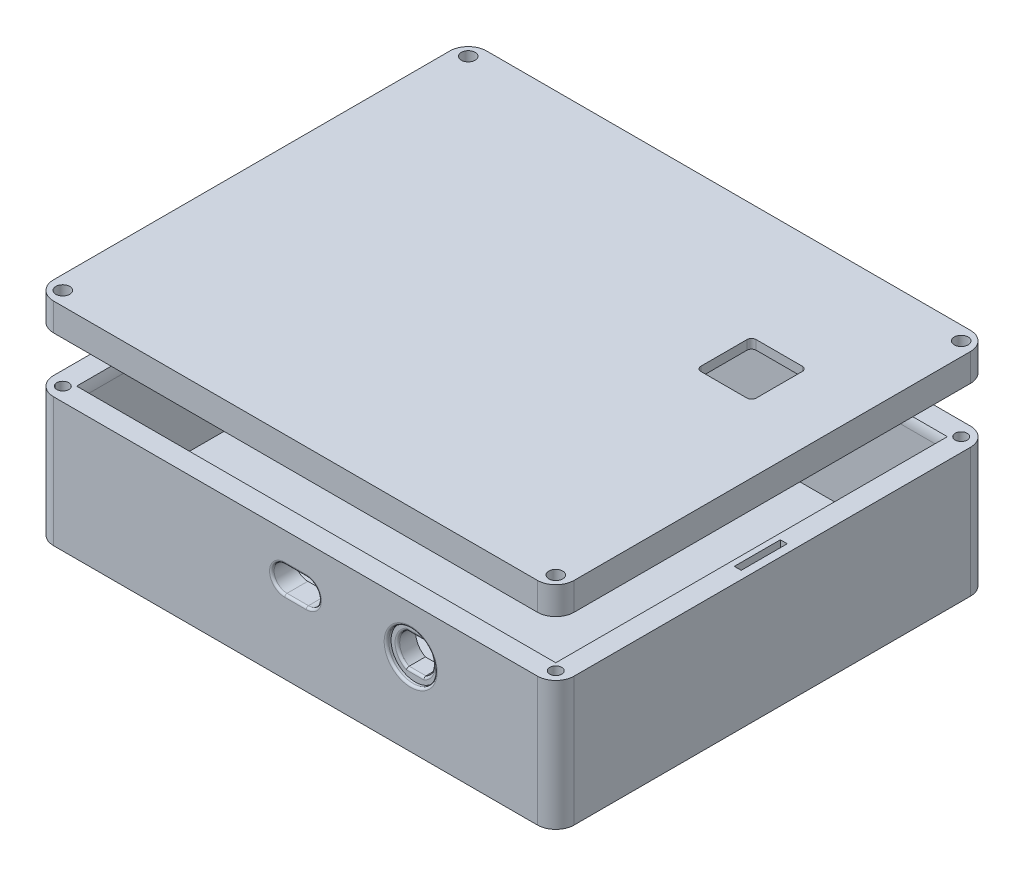
from build123d import *

# Parameters (mm, degrees)
BOSS_EXTRUDE1_DEPTH      = 4
BOSS_EXTRUDE2_START      = 4
SKETCH1_3_W              = 103
SKETCH1_3_H              = 84
BOSS_EXTRUDE2_DEPTH      = 24
BOSS_EXTRUDE3_START      = 4
SKETCH1_4_W              = 1.5
SKETCH1_4_H              = 12
SKETCH1_4_W_2            = 2.5
SKETCH1_4_H_2            = 1.5
BOSS_EXTRUDE3_DEPTH      = 8
CHAMFER1_SIZE            = 1
CUT_EXTRUDE1_DEPTH       = 11
CUT_EXTRUDE2_START       = 5
SKETCH2_3_R              = 5.25
CUT_EXTRUDE2_DEPTH       = 1
CHAMFER2_SIZE            = 0.5
FILLET1_R                = 5
FILLET2_R                = 0.5
SKETCH3_R                = 1.3
SKETCH3_W                = 1.5
SKETCH3_H                = 10
CUT_EXTRUDE3_DEPTH       = 8
SKETCH4_R                = 1.5
SKETCH4_W                = 103
SKETCH4_H                = 84
BOSS_EXTRUDE4_DEPTH      = 4
SKETCH4_5_W              = 1
SKETCH4_5_H              = 9.5
BOSS_EXTRUDE7_DEPTH      = 2
BOSS_EXTRUDE5_DEPTH      = 4
BOSS_EXTRUDE5_DEPTH_BACK = 3
SKETCH4_3_W              = 103
SKETCH4_3_H              = 84
SKETCH4_3_W_2            = 95
SKETCH4_3_H_2            = 76
CHAMFER3_SIZE            = 1
CHAMFER3_SIZE2           = 2.747477419
BOSS_EXTRUDE17_START     = 4
BOSS_EXTRUDE17_OUTLINE_R = 1.5
BOSS_EXTRUDE17_DEPTH     = 2
CUT_EXTRUDE11_DEPTH      = 10


# Read off the part's stored shape, not the designer's step: Boss-Extrude17
with BuildPart() as part:
    # Sketch1 → Boss-Extrude1 (new body)
    with BuildSketch(Plane(origin=(0, 0, 0), x_dir=(1, 0, 0), z_dir=(0, 1, 0))):
        with BuildLine():
            Line((-1, 89), (104, 89))
            ThreePointArc((104, 89), (106.828427125, 87.828427125), (108, 85))
            Line((108, 85), (108, -1))
            ThreePointArc((108, -1), (106.828427125, -3.828427125), (104, -5))
            Line((104, -5), (-1, -5))
            ThreePointArc((-1, -5), (-3.828427125, -3.828427125), (-5, -1))
            Line((-5, -1), (-5, 85))
            ThreePointArc((-5, 85), (-3.828427125, 87.828427125), (-1, 89))
        make_face()
    extrude(amount=BOSS_EXTRUDE1_DEPTH)

    # Sketch1<3> → Boss-Extrude2 (add)
    with BuildSketch(Plane(origin=(0, 0, 0), x_dir=(1, 0, 0), z_dir=(0, 1, 0)).offset(BOSS_EXTRUDE2_START)):
        with BuildLine():
            Line((-1, 89), (104, 89))
            ThreePointArc((104, 89), (106.828427125, 87.828427125), (108, 85))
            Line((108, 85), (108, -1))
            ThreePointArc((108, -1), (106.828427125, -3.828427125), (104, -5))
            Line((104, -5), (-1, -5))
            ThreePointArc((-1, -5), (-3.828427125, -3.828427125), (-5, -1))
            Line((-5, -1), (-5, 85))
            ThreePointArc((-5, 85), (-3.828427125, 87.828427125), (-1, 89))
        make_face()
        with Locations((51.5, 42)):
            Rectangle(SKETCH1_3_W, SKETCH1_3_H, mode=Mode.SUBTRACT)
    extrude(amount=BOSS_EXTRUDE2_DEPTH)

    # Sketch1<4> → Boss-Extrude3 (add)
    with BuildSketch(Plane(origin=(0, 0, 0), x_dir=(1, 0, 0), z_dir=(0, 1, 0)).offset(BOSS_EXTRUDE3_START)):
        with Locations((0.75, 78)):
            Rectangle(SKETCH1_4_W, SKETCH1_4_H)
        Polygon((0, 13.5), (0, 0), (1.5, 0), (1.5, 1.5), (1.5, 13.5), align=None)
        with Locations((2.75, 0.75)):
            Rectangle(SKETCH1_4_W_2, SKETCH1_4_H_2)
    extrude(amount=BOSS_EXTRUDE3_DEPTH)

    # Chamfer1
    chamfer1_edges = [part.edges().sort_by_distance(p)[0] for p in [
        (0.75, 12, -72),
        (1.5, 12, -78),
        (1.5, 12, -7.5),
        (0.75, 12, -13.5),
        (4, 12, -0.75),
        (2.75, 12, -1.5),
    ]]
    chamfer(chamfer1_edges, length=CHAMFER1_SIZE)

    # Sketch2 → Cut-Extrude1 (cut)
    with BuildSketch(Plane.XY):
        with BuildLine():
            Line((49.175, 15.9), (53.825, 15.9))
            ThreePointArc((53.825, 15.9), (56.625, 18.7), (53.825, 21.5))
            Line((53.825, 21.5), (49.175, 21.5))
            ThreePointArc((49.175, 21.5), (46.375, 18.7), (49.175, 15.9))
        make_face()
        with BuildLine():
            Line((74.687543104, 14.45), (78.312456896, 14.45))
            ThreePointArc((78.312456896, 14.45), (80.375, 17.875), (78.312456896, 21.3))
            Line((78.312456896, 21.3), (74.687543104, 21.3))
            ThreePointArc((74.687543104, 21.3), (72.625, 17.875), (74.687543104, 14.45))
        make_face()
    extrude(amount=CUT_EXTRUDE1_DEPTH, mode=Mode.SUBTRACT)

    # Sketch2<3> → Cut-Extrude2 (cut)
    with BuildSketch(Plane.XY.offset(CUT_EXTRUDE2_START)):
        with Locations(Location((76.5, 17.875, 0), (0, 0, 180))):
            Circle(SKETCH2_3_R)
    extrude(amount=-CUT_EXTRUDE2_DEPTH, mode=Mode.SUBTRACT)

    # Chamfer2
    chamfer2_edges = [part.edges().sort_by_distance(p)[0] for p in [
        (0, 28, -42),
        (51.5, 28, -84),
        (51.5, 28, 0),
        (103, 28, -42),
    ]]
    chamfer(chamfer2_edges, length=CHAMFER2_SIZE)

    # Fillet1
    # the kernel refuses this fillet: 5 mm, written as the material it takes off along each edge
    with BuildSketch(Plane(origin=(-4.198623679, 27.5, 0), x_dir=(0, -1, 0), z_dir=(1, 0, 0))) as fillet1_piece_1_section:
        with BuildLine():
            CenterArc((1.679449472, -5), FILLET1_R, 90, 25.841932763)
            Line((-0.5, -0.5), (-0.543588989, -0.41))
            ThreePointArc((-0.543588989, -0.41), (-0.320710678, -0.179289322), (-0.070710678, 0.070710678))
            Line((-0.070710678, 0.070710678), (0, 0.1))
            Line((0, 0.1), (1.679449472, 0.1))
            Line((1.679449472, 0.1), (1.679449472, 0))
        make_face()
    fillet1_piece_1 = extrude(amount=107.198623679, mode=Mode.PRIVATE)
    fillet1_piece_1 = split(fillet1_piece_1, bisect_by=Plane(origin=(0, 27.809434644, 0.291148334), z_dir=(-1, 0, 0)), keep=Keep.TOP, mode=Mode.PRIVATE)
    fillet1_piece_1 = split(fillet1_piece_1, bisect_by=Plane(origin=(-0.232075983, 27.732075983, 0.291148334), z_dir=(0.7071067811865476, 0.7071067811865476, 0)), keep=Keep.TOP, mode=Mode.PRIVATE)
    add(fillet1_piece_1, mode=Mode.SUBTRACT)
    with BuildSketch(Plane(origin=(0, 27.5, 0), x_dir=(0, -1, 0), z_dir=(1, 0, 0))) as fillet1_piece_2_section:
        with BuildLine():
            CenterArc((1.679449472, -5), FILLET1_R, 90, 25.841932763)
            Line((-0.5, -0.5), (-0.543588989, -0.41))
            ThreePointArc((-0.543588989, -0.41), (-0.320710678, -0.179289322), (-0.070710678, 0.070710678))
            Line((-0.070710678, 0.070710678), (0, 0.1))
            Line((0, 0.1), (1.679449472, 0.1))
            Line((1.679449472, 0.1), (1.679449472, 0))
        make_face()
    fillet1_piece_2 = extrude(amount=103, mode=Mode.PRIVATE)
    fillet1_piece_2 = split(fillet1_piece_2, bisect_by=Plane(origin=(0.730926762, 26.769073238, -0.015345382), z_dir=(-0.7071067811865476, -0.7071067811865476, 0)), keep=Keep.TOP, mode=Mode.PRIVATE)
    add(fillet1_piece_2, mode=Mode.SUBTRACT)
    with BuildSketch(Plane(origin=(0, 27.5, 0), x_dir=(0, -1, 0), z_dir=(1, 0, 0))) as fillet1_piece_3_section:
        with BuildLine():
            CenterArc((1.679449472, -5), FILLET1_R, 90, 25.841932763)
            Line((-0.5, -0.5), (-0.543588989, -0.41))
            ThreePointArc((-0.543588989, -0.41), (-0.320710678, -0.179289322), (-0.070710678, 0.070710678))
            Line((-0.070710678, 0.070710678), (0, 0.1))
            Line((0, 0.1), (1.679449472, 0.1))
            Line((1.679449472, 0.1), (1.679449472, 0))
        make_face()
    fillet1_piece_3 = extrude(amount=103, mode=Mode.PRIVATE)
    fillet1_piece_3 = split(fillet1_piece_3, bisect_by=Plane(origin=(25.936183283, 1.563816717, 0.080709019), z_dir=(0.7071067811865476, 0.7071067811865476, 0)), keep=Keep.TOP, mode=Mode.PRIVATE)
    fillet1_piece_3 = split(fillet1_piece_3, bisect_by=Plane(origin=(77.063816717, 1.563816717, 0.080709019), z_dir=(-0.7071067811865476, 0.7071067811865476, 0)), keep=Keep.TOP, mode=Mode.PRIVATE)
    add(fillet1_piece_3, mode=Mode.SUBTRACT)
    with BuildSketch(Plane(origin=(0, 27.5, 0), x_dir=(0, -1, 0), z_dir=(1, 0, 0))) as fillet1_piece_4_section:
        with BuildLine():
            CenterArc((1.679449472, -5), FILLET1_R, 90, 25.841932763)
            Line((-0.5, -0.5), (-0.543588989, -0.41))
            ThreePointArc((-0.543588989, -0.41), (-0.320710678, -0.179289322), (-0.070710678, 0.070710678))
            Line((-0.070710678, 0.070710678), (0, 0.1))
            Line((0, 0.1), (1.679449472, 0.1))
            Line((1.679449472, 0.1), (1.679449472, 0))
        make_face()
    fillet1_piece_4 = extrude(amount=107.198623679, mode=Mode.PRIVATE)
    fillet1_piece_4 = split(fillet1_piece_4, bisect_by=Plane(origin=(103, 27.809434644, 0.291148334), z_dir=(1, 0, 0)), keep=Keep.TOP, mode=Mode.PRIVATE)
    fillet1_piece_4 = split(fillet1_piece_4, bisect_by=Plane(origin=(103.232075983, 27.732075983, 0.291148334), z_dir=(-0.7071067811865476, 0.7071067811865476, 0)), keep=Keep.TOP, mode=Mode.PRIVATE)
    add(fillet1_piece_4, mode=Mode.SUBTRACT)
    with BuildSketch(Plane(origin=(0, 27.5, 0), x_dir=(0, -1, 0), z_dir=(1, 0, 0))) as fillet1_piece_5_section:
        with BuildLine():
            CenterArc((1.679449472, -5), FILLET1_R, 90, 25.841932763)
            Line((-0.5, -0.5), (-0.543588989, -0.41))
            ThreePointArc((-0.543588989, -0.41), (-0.320710678, -0.179289322), (-0.070710678, 0.070710678))
            Line((-0.070710678, 0.070710678), (0, 0.1))
            Line((0, 0.1), (1.679449472, 0.1))
            Line((1.679449472, 0.1), (1.679449472, 0))
        make_face()
    fillet1_piece_5 = extrude(amount=103, mode=Mode.PRIVATE)
    fillet1_piece_5 = split(fillet1_piece_5, bisect_by=Plane(origin=(102.269073238, 26.769073238, -0.015345382), z_dir=(0.7071067811865476, -0.7071067811865476, 0)), keep=Keep.TOP, mode=Mode.PRIVATE)
    add(fillet1_piece_5, mode=Mode.SUBTRACT)
    with BuildSketch(Plane(origin=(103, 27.5, 4.198623679), x_dir=(0, -1, 0), z_dir=(0, 0, -1))) as fillet1_piece_6_section:
        with BuildLine():
            CenterArc((1.679449472, -5), FILLET1_R, 90, 25.841932763)
            Line((-0.5, -0.5), (-0.543588989, -0.41))
            ThreePointArc((-0.543588989, -0.41), (-0.320710678, -0.179289322), (-0.070710678, 0.070710678))
            Line((-0.070710678, 0.070710678), (0, 0.1))
            Line((0, 0.1), (1.679449472, 0.1))
            Line((1.679449472, 0.1), (1.679449472, 0))
        make_face()
    fillet1_piece_6 = extrude(amount=88.198623679, mode=Mode.PRIVATE)
    fillet1_piece_6 = split(fillet1_piece_6, bisect_by=Plane(origin=(103.291148334, 27.809434644, 0), z_dir=(0, 0, 1)), keep=Keep.TOP, mode=Mode.PRIVATE)
    fillet1_piece_6 = split(fillet1_piece_6, bisect_by=Plane(origin=(103.291148334, 27.732075983, 0.232075983), z_dir=(0, 0.7071067811865476, -0.7071067811865476)), keep=Keep.TOP, mode=Mode.PRIVATE)
    add(fillet1_piece_6, mode=Mode.SUBTRACT)
    with BuildSketch(Plane(origin=(103, 27.5, 0), x_dir=(0, -1, 0), z_dir=(0, 0, -1))) as fillet1_piece_7_section:
        with BuildLine():
            CenterArc((1.679449472, -5), FILLET1_R, 90, 25.841932763)
            Line((-0.5, -0.5), (-0.543588989, -0.41))
            ThreePointArc((-0.543588989, -0.41), (-0.320710678, -0.179289322), (-0.070710678, 0.070710678))
            Line((-0.070710678, 0.070710678), (0, 0.1))
            Line((0, 0.1), (1.679449472, 0.1))
            Line((1.679449472, 0.1), (1.679449472, 0))
        make_face()
    fillet1_piece_7 = extrude(amount=84, mode=Mode.PRIVATE)
    fillet1_piece_7 = split(fillet1_piece_7, bisect_by=Plane(origin=(102.984654618, 26.769073238, -0.730926762), z_dir=(0, -0.7071067811865476, 0.7071067811865476)), keep=Keep.TOP, mode=Mode.PRIVATE)
    add(fillet1_piece_7, mode=Mode.SUBTRACT)
    with BuildSketch(Plane(origin=(103, 27.5, 0), x_dir=(0, -1, 0), z_dir=(0, 0, -1))) as fillet1_piece_8_section:
        with BuildLine():
            CenterArc((1.679449472, -5), FILLET1_R, 90, 25.841932763)
            Line((-0.5, -0.5), (-0.543588989, -0.41))
            ThreePointArc((-0.543588989, -0.41), (-0.320710678, -0.179289322), (-0.070710678, 0.070710678))
            Line((-0.070710678, 0.070710678), (0, 0.1))
            Line((0, 0.1), (1.679449472, 0.1))
            Line((1.679449472, 0.1), (1.679449472, 0))
        make_face()
    fillet1_piece_8 = extrude(amount=84, mode=Mode.PRIVATE)
    fillet1_piece_8 = split(fillet1_piece_8, bisect_by=Plane(origin=(103.080897573, 6.314407777, -21.185592223), z_dir=(0, 0.7071067811865476, -0.7071067811865476)), keep=Keep.TOP, mode=Mode.PRIVATE)
    fillet1_piece_8 = split(fillet1_piece_8, bisect_by=Plane(origin=(103.080897573, 6.314407777, -62.814407777), z_dir=(0, 0.7071067811865476, 0.7071067811865476)), keep=Keep.TOP, mode=Mode.PRIVATE)
    add(fillet1_piece_8, mode=Mode.SUBTRACT)
    with BuildSketch(Plane(origin=(103, 27.5, 0), x_dir=(0, -1, 0), z_dir=(0, 0, -1))) as fillet1_piece_9_section:
        with BuildLine():
            CenterArc((1.679449472, -5), FILLET1_R, 90, 25.841932763)
            Line((-0.5, -0.5), (-0.543588989, -0.41))
            ThreePointArc((-0.543588989, -0.41), (-0.320710678, -0.179289322), (-0.070710678, 0.070710678))
            Line((-0.070710678, 0.070710678), (0, 0.1))
            Line((0, 0.1), (1.679449472, 0.1))
            Line((1.679449472, 0.1), (1.679449472, 0))
        make_face()
    fillet1_piece_9 = extrude(amount=88.198623679, mode=Mode.PRIVATE)
    fillet1_piece_9 = split(fillet1_piece_9, bisect_by=Plane(origin=(103.291148334, 27.809434644, -84), z_dir=(0, 0, -1)), keep=Keep.TOP, mode=Mode.PRIVATE)
    fillet1_piece_9 = split(fillet1_piece_9, bisect_by=Plane(origin=(103.291148334, 27.732075983, -84.232075983), z_dir=(0, 0.7071067811865476, 0.7071067811865476)), keep=Keep.TOP, mode=Mode.PRIVATE)
    add(fillet1_piece_9, mode=Mode.SUBTRACT)
    with BuildSketch(Plane(origin=(103, 27.5, 0), x_dir=(0, -1, 0), z_dir=(0, 0, -1))) as fillet1_piece_10_section:
        with BuildLine():
            CenterArc((1.679449472, -5), FILLET1_R, 90, 25.841932763)
            Line((-0.5, -0.5), (-0.543588989, -0.41))
            ThreePointArc((-0.543588989, -0.41), (-0.320710678, -0.179289322), (-0.070710678, 0.070710678))
            Line((-0.070710678, 0.070710678), (0, 0.1))
            Line((0, 0.1), (1.679449472, 0.1))
            Line((1.679449472, 0.1), (1.679449472, 0))
        make_face()
    fillet1_piece_10 = extrude(amount=84, mode=Mode.PRIVATE)
    fillet1_piece_10 = split(fillet1_piece_10, bisect_by=Plane(origin=(102.984654618, 26.769073238, -83.269073238), z_dir=(0, -0.7071067811865476, -0.7071067811865476)), keep=Keep.TOP, mode=Mode.PRIVATE)
    add(fillet1_piece_10, mode=Mode.SUBTRACT)
    with BuildSketch(Plane(origin=(107.198623679, 27.5, -84), x_dir=(0, -1, 0), z_dir=(-1, 0, 0))) as fillet1_piece_11_section:
        with BuildLine():
            CenterArc((1.679449472, -5), FILLET1_R, 90, 25.841932763)
            Line((-0.5, -0.5), (-0.543588989, -0.41))
            ThreePointArc((-0.543588989, -0.41), (-0.320710678, -0.179289322), (-0.070710678, 0.070710678))
            Line((-0.070710678, 0.070710678), (0, 0.1))
            Line((0, 0.1), (1.679449472, 0.1))
            Line((1.679449472, 0.1), (1.679449472, 0))
        make_face()
    fillet1_piece_11 = extrude(amount=107.198623679, mode=Mode.PRIVATE)
    fillet1_piece_11 = split(fillet1_piece_11, bisect_by=Plane(origin=(103, 27.809434644, -84.291148334), z_dir=(1, 0, 0)), keep=Keep.TOP, mode=Mode.PRIVATE)
    fillet1_piece_11 = split(fillet1_piece_11, bisect_by=Plane(origin=(103.232075983, 27.732075983, -84.291148334), z_dir=(-0.7071067811865476, 0.7071067811865476, 0)), keep=Keep.TOP, mode=Mode.PRIVATE)
    add(fillet1_piece_11, mode=Mode.SUBTRACT)
    with BuildSketch(Plane(origin=(103, 27.5, -84), x_dir=(0, -1, 0), z_dir=(-1, 0, 0))) as fillet1_piece_12_section:
        with BuildLine():
            CenterArc((1.679449472, -5), FILLET1_R, 90, 25.841932763)
            Line((-0.5, -0.5), (-0.543588989, -0.41))
            ThreePointArc((-0.543588989, -0.41), (-0.320710678, -0.179289322), (-0.070710678, 0.070710678))
            Line((-0.070710678, 0.070710678), (0, 0.1))
            Line((0, 0.1), (1.679449472, 0.1))
            Line((1.679449472, 0.1), (1.679449472, 0))
        make_face()
    fillet1_piece_12 = extrude(amount=103, mode=Mode.PRIVATE)
    fillet1_piece_12 = split(fillet1_piece_12, bisect_by=Plane(origin=(102.269073238, 26.769073238, -83.984654618), z_dir=(0.7071067811865476, -0.7071067811865476, 0)), keep=Keep.TOP, mode=Mode.PRIVATE)
    add(fillet1_piece_12, mode=Mode.SUBTRACT)
    with BuildSketch(Plane(origin=(103, 27.5, -84), x_dir=(0, -1, 0), z_dir=(-1, 0, 0))) as fillet1_piece_13_section:
        with BuildLine():
            CenterArc((1.679449472, -5), FILLET1_R, 90, 25.841932763)
            Line((-0.5, -0.5), (-0.543588989, -0.41))
            ThreePointArc((-0.543588989, -0.41), (-0.320710678, -0.179289322), (-0.070710678, 0.070710678))
            Line((-0.070710678, 0.070710678), (0, 0.1))
            Line((0, 0.1), (1.679449472, 0.1))
            Line((1.679449472, 0.1), (1.679449472, 0))
        make_face()
    fillet1_piece_13 = extrude(amount=103, mode=Mode.PRIVATE)
    fillet1_piece_13 = split(fillet1_piece_13, bisect_by=Plane(origin=(25.936183283, 1.563816717, -84.080709019), z_dir=(0.7071067811865476, 0.7071067811865476, 0)), keep=Keep.TOP, mode=Mode.PRIVATE)
    fillet1_piece_13 = split(fillet1_piece_13, bisect_by=Plane(origin=(77.063816717, 1.563816717, -84.080709019), z_dir=(-0.7071067811865476, 0.7071067811865476, 0)), keep=Keep.TOP, mode=Mode.PRIVATE)
    add(fillet1_piece_13, mode=Mode.SUBTRACT)
    with BuildSketch(Plane(origin=(103, 27.5, -84), x_dir=(0, -1, 0), z_dir=(-1, 0, 0))) as fillet1_piece_14_section:
        with BuildLine():
            CenterArc((1.679449472, -5), FILLET1_R, 90, 25.841932763)
            Line((-0.5, -0.5), (-0.543588989, -0.41))
            ThreePointArc((-0.543588989, -0.41), (-0.320710678, -0.179289322), (-0.070710678, 0.070710678))
            Line((-0.070710678, 0.070710678), (0, 0.1))
            Line((0, 0.1), (1.679449472, 0.1))
            Line((1.679449472, 0.1), (1.679449472, 0))
        make_face()
    fillet1_piece_14 = extrude(amount=107.198623679, mode=Mode.PRIVATE)
    fillet1_piece_14 = split(fillet1_piece_14, bisect_by=Plane(origin=(0, 27.809434644, -84.291148334), z_dir=(-1, 0, 0)), keep=Keep.TOP, mode=Mode.PRIVATE)
    fillet1_piece_14 = split(fillet1_piece_14, bisect_by=Plane(origin=(-0.232075983, 27.732075983, -84.291148334), z_dir=(0.7071067811865476, 0.7071067811865476, 0)), keep=Keep.TOP, mode=Mode.PRIVATE)
    add(fillet1_piece_14, mode=Mode.SUBTRACT)
    with BuildSketch(Plane(origin=(103, 27.5, -84), x_dir=(0, -1, 0), z_dir=(-1, 0, 0))) as fillet1_piece_15_section:
        with BuildLine():
            CenterArc((1.679449472, -5), FILLET1_R, 90, 25.841932763)
            Line((-0.5, -0.5), (-0.543588989, -0.41))
            ThreePointArc((-0.543588989, -0.41), (-0.320710678, -0.179289322), (-0.070710678, 0.070710678))
            Line((-0.070710678, 0.070710678), (0, 0.1))
            Line((0, 0.1), (1.679449472, 0.1))
            Line((1.679449472, 0.1), (1.679449472, 0))
        make_face()
    fillet1_piece_15 = extrude(amount=103, mode=Mode.PRIVATE)
    fillet1_piece_15 = split(fillet1_piece_15, bisect_by=Plane(origin=(0.730926762, 26.769073238, -83.984654618), z_dir=(-0.7071067811865476, -0.7071067811865476, 0)), keep=Keep.TOP, mode=Mode.PRIVATE)
    add(fillet1_piece_15, mode=Mode.SUBTRACT)
    with BuildSketch(Plane(origin=(0, 27.5, -88.198623679), x_dir=(0, -1, 0), z_dir=(0, 0, 1))) as fillet1_piece_16_section:
        with BuildLine():
            CenterArc((1.679449472, -5), FILLET1_R, 90, 25.841932763)
            Line((-0.5, -0.5), (-0.543588989, -0.41))
            ThreePointArc((-0.543588989, -0.41), (-0.320710678, -0.179289322), (-0.070710678, 0.070710678))
            Line((-0.070710678, 0.070710678), (0, 0.1))
            Line((0, 0.1), (1.679449472, 0.1))
            Line((1.679449472, 0.1), (1.679449472, 0))
        make_face()
    fillet1_piece_16 = extrude(amount=88.198623679, mode=Mode.PRIVATE)
    fillet1_piece_16 = split(fillet1_piece_16, bisect_by=Plane(origin=(-0.291148334, 27.809434644, -84), z_dir=(0, 0, -1)), keep=Keep.TOP, mode=Mode.PRIVATE)
    fillet1_piece_16 = split(fillet1_piece_16, bisect_by=Plane(origin=(-0.291148334, 27.732075983, -84.232075983), z_dir=(0, 0.7071067811865476, 0.7071067811865476)), keep=Keep.TOP, mode=Mode.PRIVATE)
    add(fillet1_piece_16, mode=Mode.SUBTRACT)
    with BuildSketch(Plane(origin=(0, 27.5, -84), x_dir=(0, -1, 0), z_dir=(0, 0, 1))) as fillet1_piece_17_section:
        with BuildLine():
            CenterArc((1.679449472, -5), FILLET1_R, 90, 25.841932763)
            Line((-0.5, -0.5), (-0.543588989, -0.41))
            ThreePointArc((-0.543588989, -0.41), (-0.320710678, -0.179289322), (-0.070710678, 0.070710678))
            Line((-0.070710678, 0.070710678), (0, 0.1))
            Line((0, 0.1), (1.679449472, 0.1))
            Line((1.679449472, 0.1), (1.679449472, 0))
        make_face()
    fillet1_piece_17 = extrude(amount=84, mode=Mode.PRIVATE)
    fillet1_piece_17 = split(fillet1_piece_17, bisect_by=Plane(origin=(0.015345382, 26.769073238, -83.269073238), z_dir=(0, -0.7071067811865476, -0.7071067811865476)), keep=Keep.TOP, mode=Mode.PRIVATE)
    add(fillet1_piece_17, mode=Mode.SUBTRACT)
    with BuildSketch(Plane(origin=(0, 27.5, -84), x_dir=(0, -1, 0), z_dir=(0, 0, 1))) as fillet1_piece_18_section:
        with BuildLine():
            CenterArc((1.679449472, -5), FILLET1_R, 90, 25.841932763)
            Line((-0.5, -0.5), (-0.543588989, -0.41))
            ThreePointArc((-0.543588989, -0.41), (-0.320710678, -0.179289322), (-0.070710678, 0.070710678))
            Line((-0.070710678, 0.070710678), (0, 0.1))
            Line((0, 0.1), (1.679449472, 0.1))
            Line((1.679449472, 0.1), (1.679449472, 0))
        make_face()
    fillet1_piece_18 = extrude(amount=84, mode=Mode.PRIVATE)
    fillet1_piece_18 = split(fillet1_piece_18, bisect_by=Plane(origin=(-0.080897573, 6.314407777, -21.185592223), z_dir=(0, 0.7071067811865476, -0.7071067811865476)), keep=Keep.TOP, mode=Mode.PRIVATE)
    fillet1_piece_18 = split(fillet1_piece_18, bisect_by=Plane(origin=(-0.080897573, 6.314407777, -62.814407777), z_dir=(0, 0.7071067811865476, 0.7071067811865476)), keep=Keep.TOP, mode=Mode.PRIVATE)
    add(fillet1_piece_18, mode=Mode.SUBTRACT)
    with BuildSketch(Plane(origin=(0, 27.5, -84), x_dir=(0, -1, 0), z_dir=(0, 0, 1))) as fillet1_piece_19_section:
        with BuildLine():
            CenterArc((1.679449472, -5), FILLET1_R, 90, 25.841932763)
            Line((-0.5, -0.5), (-0.543588989, -0.41))
            ThreePointArc((-0.543588989, -0.41), (-0.320710678, -0.179289322), (-0.070710678, 0.070710678))
            Line((-0.070710678, 0.070710678), (0, 0.1))
            Line((0, 0.1), (1.679449472, 0.1))
            Line((1.679449472, 0.1), (1.679449472, 0))
        make_face()
    fillet1_piece_19 = extrude(amount=88.198623679, mode=Mode.PRIVATE)
    fillet1_piece_19 = split(fillet1_piece_19, bisect_by=Plane(origin=(-0.291148334, 27.809434644, 0), z_dir=(0, 0, 1)), keep=Keep.TOP, mode=Mode.PRIVATE)
    fillet1_piece_19 = split(fillet1_piece_19, bisect_by=Plane(origin=(-0.291148334, 27.732075983, 0.232075983), z_dir=(0, 0.7071067811865476, -0.7071067811865476)), keep=Keep.TOP, mode=Mode.PRIVATE)
    add(fillet1_piece_19, mode=Mode.SUBTRACT)
    with BuildSketch(Plane(origin=(0, 27.5, -84), x_dir=(0, -1, 0), z_dir=(0, 0, 1))) as fillet1_piece_20_section:
        with BuildLine():
            CenterArc((1.679449472, -5), FILLET1_R, 90, 25.841932763)
            Line((-0.5, -0.5), (-0.543588989, -0.41))
            ThreePointArc((-0.543588989, -0.41), (-0.320710678, -0.179289322), (-0.070710678, 0.070710678))
            Line((-0.070710678, 0.070710678), (0, 0.1))
            Line((0, 0.1), (1.679449472, 0.1))
            Line((1.679449472, 0.1), (1.679449472, 0))
        make_face()
    fillet1_piece_20 = extrude(amount=84, mode=Mode.PRIVATE)
    fillet1_piece_20 = split(fillet1_piece_20, bisect_by=Plane(origin=(0.015345382, 26.769073238, -0.730926762), z_dir=(0, -0.7071067811865476, 0.7071067811865476)), keep=Keep.TOP, mode=Mode.PRIVATE)
    add(fillet1_piece_20, mode=Mode.SUBTRACT)
    with BuildSketch(Plane(origin=(-4.198623679, 27.5, 0), x_dir=(0, -1, 0), z_dir=(1, 0, 0))) as fillet1_piece_21a_section:
        with BuildLine():
            CenterArc((1.679449472, -5), FILLET1_R, 90, 25.841932763)
            Line((-0.5, -0.5), (-0.543588989, -0.41))
            ThreePointArc((-0.543588989, -0.41), (-0.320710678, -0.179289322), (-0.070710678, 0.070710678))
            Line((-0.070710678, 0.070710678), (0, 0.1))
            Line((0, 0.1), (1.679449472, 0.1))
            Line((1.679449472, 0.1), (1.679449472, 0))
        make_face()
    fillet1_piece_21a = extrude(amount=107.198623679, mode=Mode.PRIVATE)
    fillet1_piece_21a = split(fillet1_piece_21a, bisect_by=Plane(origin=(0, 27.111710691, 0.076577768), z_dir=(-1, 0, 0)), keep=Keep.TOP, mode=Mode.PRIVATE)
    fillet1_piece_21a = split(fillet1_piece_21a, bisect_by=Plane(origin=(-0.870728347, 28.370728347, 0.076577768), z_dir=(-0.7071067811865476, -0.7071067811865476, 0)), keep=Keep.TOP, mode=Mode.PRIVATE)
    with BuildSketch(Plane(origin=(0, 27.5, -84), x_dir=(0, -1, 0), z_dir=(0, 0, 1))) as fillet1_piece_21b_section:
        with BuildLine():
            CenterArc((1.679449472, -5), FILLET1_R, 90, 25.841932763)
            Line((-0.5, -0.5), (-0.543588989, -0.41))
            ThreePointArc((-0.543588989, -0.41), (-0.320710678, -0.179289322), (-0.070710678, 0.070710678))
            Line((-0.070710678, 0.070710678), (0, 0.1))
            Line((0, 0.1), (1.679449472, 0.1))
            Line((1.679449472, 0.1), (1.679449472, 0))
        make_face()
    fillet1_piece_21b = extrude(amount=88.198623679, mode=Mode.PRIVATE)
    fillet1_piece_21b = split(fillet1_piece_21b, bisect_by=Plane(origin=(-0.076577768, 27.111710691, 0), z_dir=(0, 0, 1)), keep=Keep.TOP, mode=Mode.PRIVATE)
    fillet1_piece_21b = split(fillet1_piece_21b, bisect_by=Plane(origin=(-0.076577768, 28.370728347, 0.870728347), z_dir=(0, -0.7071067811865476, 0.7071067811865476)), keep=Keep.TOP, mode=Mode.PRIVATE)
    fillet1_piece_21 = fillet1_piece_21a & fillet1_piece_21b
    add(fillet1_piece_21, mode=Mode.SUBTRACT)
    with BuildSketch(Plane(origin=(0, 27.5, 0), x_dir=(0, -1, 0), z_dir=(1, 0, 0))) as fillet1_piece_22a_section:
        with BuildLine():
            CenterArc((1.679449472, -5), FILLET1_R, 90, 25.841932763)
            Line((-0.5, -0.5), (-0.543588989, -0.41))
            ThreePointArc((-0.543588989, -0.41), (-0.320710678, -0.179289322), (-0.070710678, 0.070710678))
            Line((-0.070710678, 0.070710678), (0, 0.1))
            Line((0, 0.1), (1.679449472, 0.1))
            Line((1.679449472, 0.1), (1.679449472, 0))
        make_face()
    fillet1_piece_22a = extrude(amount=107.198623679, mode=Mode.PRIVATE)
    fillet1_piece_22a = split(fillet1_piece_22a, bisect_by=Plane(origin=(103, 27.111710691, 0.076577768), z_dir=(1, 0, 0)), keep=Keep.TOP, mode=Mode.PRIVATE)
    fillet1_piece_22a = split(fillet1_piece_22a, bisect_by=Plane(origin=(103.870728347, 28.370728347, 0.076577768), z_dir=(0.7071067811865476, -0.7071067811865476, 0)), keep=Keep.TOP, mode=Mode.PRIVATE)
    with BuildSketch(Plane(origin=(103, 27.5, 4.198623679), x_dir=(0, -1, 0), z_dir=(0, 0, -1))) as fillet1_piece_22b_section:
        with BuildLine():
            CenterArc((1.679449472, -5), FILLET1_R, 90, 25.841932763)
            Line((-0.5, -0.5), (-0.543588989, -0.41))
            ThreePointArc((-0.543588989, -0.41), (-0.320710678, -0.179289322), (-0.070710678, 0.070710678))
            Line((-0.070710678, 0.070710678), (0, 0.1))
            Line((0, 0.1), (1.679449472, 0.1))
            Line((1.679449472, 0.1), (1.679449472, 0))
        make_face()
    fillet1_piece_22b = extrude(amount=88.198623679, mode=Mode.PRIVATE)
    fillet1_piece_22b = split(fillet1_piece_22b, bisect_by=Plane(origin=(103.076577768, 27.111710691, 0), z_dir=(0, 0, 1)), keep=Keep.TOP, mode=Mode.PRIVATE)
    fillet1_piece_22b = split(fillet1_piece_22b, bisect_by=Plane(origin=(103.076577768, 28.370728347, 0.870728347), z_dir=(0, -0.7071067811865476, 0.7071067811865476)), keep=Keep.TOP, mode=Mode.PRIVATE)
    fillet1_piece_22 = fillet1_piece_22a & fillet1_piece_22b
    add(fillet1_piece_22, mode=Mode.SUBTRACT)
    with BuildSketch(Plane(origin=(103, 27.5, 0), x_dir=(0, -1, 0), z_dir=(0, 0, -1))) as fillet1_piece_23a_section:
        with BuildLine():
            CenterArc((1.679449472, -5), FILLET1_R, 90, 25.841932763)
            Line((-0.5, -0.5), (-0.543588989, -0.41))
            ThreePointArc((-0.543588989, -0.41), (-0.320710678, -0.179289322), (-0.070710678, 0.070710678))
            Line((-0.070710678, 0.070710678), (0, 0.1))
            Line((0, 0.1), (1.679449472, 0.1))
            Line((1.679449472, 0.1), (1.679449472, 0))
        make_face()
    fillet1_piece_23a = extrude(amount=88.198623679, mode=Mode.PRIVATE)
    fillet1_piece_23a = split(fillet1_piece_23a, bisect_by=Plane(origin=(103.076577768, 27.111710691, -84), z_dir=(0, 0, -1)), keep=Keep.TOP, mode=Mode.PRIVATE)
    fillet1_piece_23a = split(fillet1_piece_23a, bisect_by=Plane(origin=(103.076577768, 28.370728347, -84.870728347), z_dir=(0, -0.7071067811865476, -0.7071067811865476)), keep=Keep.TOP, mode=Mode.PRIVATE)
    with BuildSketch(Plane(origin=(107.198623679, 27.5, -84), x_dir=(0, -1, 0), z_dir=(-1, 0, 0))) as fillet1_piece_23b_section:
        with BuildLine():
            CenterArc((1.679449472, -5), FILLET1_R, 90, 25.841932763)
            Line((-0.5, -0.5), (-0.543588989, -0.41))
            ThreePointArc((-0.543588989, -0.41), (-0.320710678, -0.179289322), (-0.070710678, 0.070710678))
            Line((-0.070710678, 0.070710678), (0, 0.1))
            Line((0, 0.1), (1.679449472, 0.1))
            Line((1.679449472, 0.1), (1.679449472, 0))
        make_face()
    fillet1_piece_23b = extrude(amount=107.198623679, mode=Mode.PRIVATE)
    fillet1_piece_23b = split(fillet1_piece_23b, bisect_by=Plane(origin=(103, 27.111710691, -84.076577768), z_dir=(1, 0, 0)), keep=Keep.TOP, mode=Mode.PRIVATE)
    fillet1_piece_23b = split(fillet1_piece_23b, bisect_by=Plane(origin=(103.870728347, 28.370728347, -84.076577768), z_dir=(0.7071067811865476, -0.7071067811865476, 0)), keep=Keep.TOP, mode=Mode.PRIVATE)
    fillet1_piece_23 = fillet1_piece_23a & fillet1_piece_23b
    add(fillet1_piece_23, mode=Mode.SUBTRACT)
    with BuildSketch(Plane(origin=(0, 27.5, -88.198623679), x_dir=(0, -1, 0), z_dir=(0, 0, 1))) as fillet1_piece_24a_section:
        with BuildLine():
            CenterArc((1.679449472, -5), FILLET1_R, 90, 25.841932763)
            Line((-0.5, -0.5), (-0.543588989, -0.41))
            ThreePointArc((-0.543588989, -0.41), (-0.320710678, -0.179289322), (-0.070710678, 0.070710678))
            Line((-0.070710678, 0.070710678), (0, 0.1))
            Line((0, 0.1), (1.679449472, 0.1))
            Line((1.679449472, 0.1), (1.679449472, 0))
        make_face()
    fillet1_piece_24a = extrude(amount=88.198623679, mode=Mode.PRIVATE)
    fillet1_piece_24a = split(fillet1_piece_24a, bisect_by=Plane(origin=(-0.076577768, 27.111710691, -84), z_dir=(0, 0, -1)), keep=Keep.TOP, mode=Mode.PRIVATE)
    fillet1_piece_24a = split(fillet1_piece_24a, bisect_by=Plane(origin=(-0.076577768, 28.370728347, -84.870728347), z_dir=(0, -0.7071067811865476, -0.7071067811865476)), keep=Keep.TOP, mode=Mode.PRIVATE)
    with BuildSketch(Plane(origin=(103, 27.5, -84), x_dir=(0, -1, 0), z_dir=(-1, 0, 0))) as fillet1_piece_24b_section:
        with BuildLine():
            CenterArc((1.679449472, -5), FILLET1_R, 90, 25.841932763)
            Line((-0.5, -0.5), (-0.543588989, -0.41))
            ThreePointArc((-0.543588989, -0.41), (-0.320710678, -0.179289322), (-0.070710678, 0.070710678))
            Line((-0.070710678, 0.070710678), (0, 0.1))
            Line((0, 0.1), (1.679449472, 0.1))
            Line((1.679449472, 0.1), (1.679449472, 0))
        make_face()
    fillet1_piece_24b = extrude(amount=107.198623679, mode=Mode.PRIVATE)
    fillet1_piece_24b = split(fillet1_piece_24b, bisect_by=Plane(origin=(0, 27.111710691, -84.076577768), z_dir=(-1, 0, 0)), keep=Keep.TOP, mode=Mode.PRIVATE)
    fillet1_piece_24b = split(fillet1_piece_24b, bisect_by=Plane(origin=(-0.870728347, 28.370728347, -84.076577768), z_dir=(-0.7071067811865476, -0.7071067811865476, 0)), keep=Keep.TOP, mode=Mode.PRIVATE)
    fillet1_piece_24 = fillet1_piece_24a & fillet1_piece_24b
    add(fillet1_piece_24, mode=Mode.SUBTRACT)

    # Fillet2
    fillet2_edges = [part.edges().sort_by_distance(p)[0] for p in [
        (46.375, 18.7, 5),
        (51.5, 21.5, 5),
        (56.625, 18.7, 5),
        (51.5, 15.9, 5),
        (72.625, 17.875, 4),
        (80.375, 17.875, 4),
        (76.5, 14.45, 4),
        (81.75, 17.875, 5),
        (76.5, 21.3, 4),
    ]]
    fillet(fillet2_edges, radius=FILLET2_R)

    # Sketch3 → Cut-Extrude3 (cut)
    with BuildSketch(Plane(origin=(0, 28, 0), x_dir=(1, 0, 0), z_dir=(0, 1, 0))):
        with Locations(Location((-2, 86, 0), (0, 0, 270))):
            Circle(SKETCH3_R)
        with Locations(Location((105, 86, 0), (0, 0, 270))):
            Circle(SKETCH3_R)
        with Locations(Location((105, -2, 0), (0, 0, 270))):
            Circle(SKETCH3_R)
        with Locations(Location((-2, -2, 0), (0, 0, 270))):
            Circle(SKETCH3_R)
        with Locations((-2.5, 42)):
            Rectangle(SKETCH3_W, SKETCH3_H)
        with Locations((105.5, 42)):
            Rectangle(SKETCH3_W, SKETCH3_H)
    extrude(amount=-CUT_EXTRUDE3_DEPTH, mode=Mode.SUBTRACT)


with BuildPart() as body_2:
    # Sketch4 → Boss-Extrude4 (new body)
    with BuildSketch(Plane(origin=(0, 40, 0), x_dir=(1, 0, 0), z_dir=(0, 1, 0))):
        with BuildLine():
            Line((104, 89), (-1, 89))
            ThreePointArc((-1, 89), (-3.828427125, 87.828427125), (-5, 85))
            Line((-5, 85), (-5, -1))
            ThreePointArc((-5, -1), (-3.828427125, -3.828427125), (-1, -5))
            Line((-1, -5), (104, -5))
            ThreePointArc((104, -5), (106.828427125, -3.828427125), (108, -1))
            Line((108, -1), (108, 85))
            ThreePointArc((108, 85), (106.828427125, 87.828427125), (104, 89))
        make_face()
        with Locations(Location((-2, -2, 0), (0, 0, 270))):
            Circle(SKETCH4_R, mode=Mode.SUBTRACT)
        with Locations(Location((-2, 86, 0), (0, 0, 270))):
            Circle(SKETCH4_R, mode=Mode.SUBTRACT)
        with Locations(Location((105, 86, 0), (0, 0, 270))):
            Circle(SKETCH4_R, mode=Mode.SUBTRACT)
        with Locations(Location((105, -2, 0), (0, 0, 270))):
            Circle(SKETCH4_R, mode=Mode.SUBTRACT)
        with Locations((51.5, 42)):
            Rectangle(SKETCH4_W, SKETCH4_H, mode=Mode.SUBTRACT)
    extrude(amount=BOSS_EXTRUDE4_DEPTH)

    # Sketch4<5> → Boss-Extrude7 (add)
    with BuildSketch(Plane(origin=(0, 40, 0), x_dir=(1, 0, 0), z_dir=(0, 1, 0))):
        with Locations((-2.5, 42)):
            Rectangle(SKETCH4_5_W, SKETCH4_5_H)
        with Locations((105.5, 42)):
            Rectangle(SKETCH4_5_W, SKETCH4_5_H)
    extrude(amount=-BOSS_EXTRUDE7_DEPTH)

    # Sketch4<3> → Boss-Extrude5 (add, two sides: drawn at the far end of the back side and taken through both)
    with BuildSketch(Plane(origin=(0, 40, 0), x_dir=(1, 0, 0), z_dir=(0, 1, 0)).offset(-BOSS_EXTRUDE5_DEPTH_BACK)):
        with Locations((51.5, 42)):
            Rectangle(SKETCH4_3_W, SKETCH4_3_H)
        with Locations((51.5, 42)):
            Rectangle(SKETCH4_3_W_2, SKETCH4_3_H_2, mode=Mode.SUBTRACT)
    extrude(amount=BOSS_EXTRUDE5_DEPTH + BOSS_EXTRUDE5_DEPTH_BACK)

    # Chamfer3
    chamfer3_edges = [body_2.edges().sort_by_distance(p)[0] for p in [
        (51.5, 37, -84),
        (103, 37, -42),
        (51.5, 37, 0),
        (0, 37, -42),
    ]]
    chamfer3_side = [body_2.faces().sort_by_distance(p)[0] for p in [
        (51.5, 37, -82.670902562),
    ]]
    chamfer(chamfer3_edges, length=CHAMFER3_SIZE, length2=CHAMFER3_SIZE2, reference=chamfer3_side[0])

    # Boss-Extrude17 outline → Boss-Extrude17 (add)
    with BuildSketch(Plane(origin=(0, 40, 0), x_dir=(1, 0, 0), z_dir=(0, 1, 0)).offset(BOSS_EXTRUDE17_START)):
        with BuildLine():
            ThreePointArc((-1, 89), (-3.828427125, 87.828427125), (-5, 85))
            Line((-5, 85), (-5, -1))
            ThreePointArc((-5, -1), (-3.828427125, -3.828427125), (-1, -5))
            Line((-1, -5), (104, -5))
            ThreePointArc((104, -5), (106.828427125, -3.828427125), (108, -1))
            Line((108, -1), (108, 85))
            ThreePointArc((108, 85), (106.828427125, 87.828427125), (104, 89))
            Line((104, 89), (-1, 89))
        make_face()
        with Locations((-2, -2)):
            Circle(BOSS_EXTRUDE17_OUTLINE_R, mode=Mode.SUBTRACT)
        with Locations((105, -2)):
            Circle(BOSS_EXTRUDE17_OUTLINE_R, mode=Mode.SUBTRACT)
        with Locations((-2, 86)):
            Circle(BOSS_EXTRUDE17_OUTLINE_R, mode=Mode.SUBTRACT)
        with Locations((105, 86)):
            Circle(BOSS_EXTRUDE17_OUTLINE_R, mode=Mode.SUBTRACT)
    extrude(amount=BOSS_EXTRUDE17_DEPTH)

    # Sketch15 → Cut-Extrude11 (cut)
    with BuildSketch(Plane(origin=(0, 46, 0), x_dir=(1, 0, 0), z_dir=(0, 1, 0))):
        with BuildLine():
            Line((82.5, 52), (92.5, 52))
            ThreePointArc((92.5, 52), (93.207106781, 52.292893219), (93.5, 53))
            Line((93.5, 53), (93.5, 63))
            ThreePointArc((93.5, 63), (93.207106781, 63.707106781), (92.5, 64))
            Line((92.5, 64), (82.5, 64))
            ThreePointArc((82.5, 64), (81.792893219, 63.707106781), (81.5, 63))
            Line((81.5, 63), (81.5, 53))
            ThreePointArc((81.5, 53), (81.792893219, 52.292893219), (82.5, 52))
        make_face()
    extrude(amount=-CUT_EXTRUDE11_DEPTH, mode=Mode.SUBTRACT)


solid = Compound([part.part, body_2.part])
